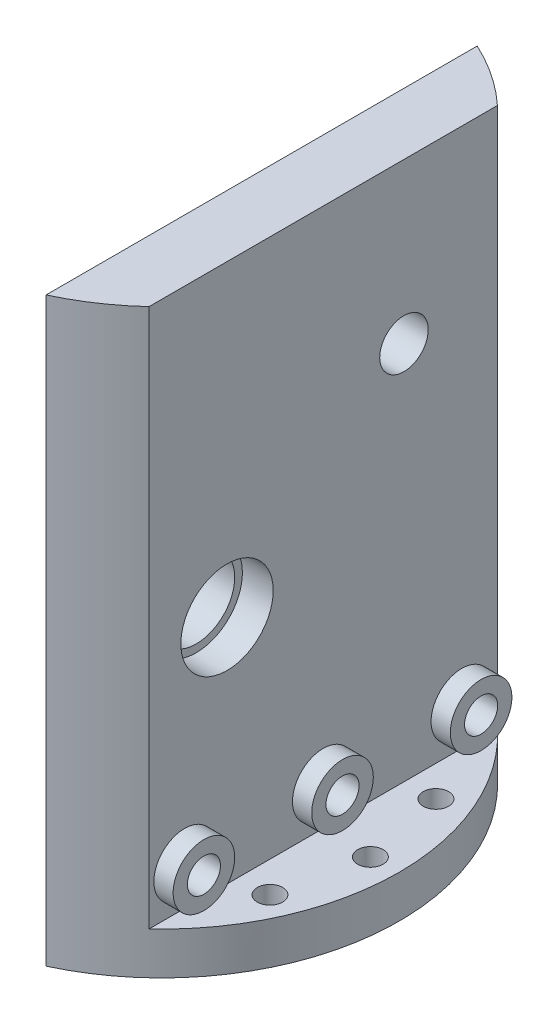
from build123d import *

# Parameters (mm, degrees)
SKETCH1_R                = 28
BOSS_EXTRUDE1_DEPTH      = 3
SKETCH2_R                = 1.625
CUT_EXTRUDE1_DEPTH       = 3
BOSS_EXTRUDE4_START      = 3
BOSS_EXTRUDE4_OUTLINE_R  = 1.625
BOSS_EXTRUDE4_DEPTH      = 70
BOSS_EXTRUDE6_DEPTH      = 7
CUT_EXTRUDE13_START      = -10
CUT_EXTRUDE13_DEPTH      = 10
SKETCH14_R               = 6
CUT_EXTRUDE7_DEPTH       = 4
SKETCH15_R               = 5
CUT_EXTRUDE8_DEPTH       = 37
SKETCH17_R               = 2.15
CUT_EXTRUDE10_DEPTH      = 15.8
CUT_EXTRUDE11_DEPTH      = 5
CUT_EXTRUDE12_START      = -3
CUT_EXTRUDE12_DEPTH      = 3
SKETCH21_W               = 20.621892052
SKETCH21_H               = 10
BOSS_EXTRUDE7_DEPTH      = 7
SKETCH23_R               = 2.15
CUT_EXTRUDE17_DEPTH      = 23
SKETCH25_W               = 2
SKETCH25_H               = 4.7
CUT_EXTRUDE19_DEPTH      = 5
SKETCH26_W               = 20.621892052
SKETCH26_H               = 58
CUT_EXTRUDE21_DEPTH      = 5
CUT_EXTRUDE22_DEPTH      = 5
SKETCH41_R               = 1.625
CUT_EXTRUDE23_DEPTH      = 70
CUT_EXTRUDE24_START      = -39
CUT_EXTRUDE24_DEPTH      = 39
BOSS_EXTRUDE12_START     = -3
SKETCH43_R               = 30.866648668
BOSS_EXTRUDE12_DEPTH     = 3
BOSS_EXTRUDE13_DEPTH     = 70
BOSS_EXTRUDE14_DEPTH     = 70
SKETCH47_R               = 1.625
SKETCH47_R_2             = 1.65
CUT_EXTRUDE26_DEPTH      = 39
SKETCH48_R               = 3.15
CUT_EXTRUDE27_DEPTH      = 39
SKETCH49_R               = 5
CUT_EXTRUDE28_DEPTH      = 10
SKETCH50_R               = 6
CUT_EXTRUDE29_DEPTH      = 4
SKETCH51_R               = 3
CUT_EXTRUDE30_DEPTH      = 2.5
CUT_EXTRUDE31_DEPTH      = 82
CUT_EXTRUDE31_DEPTH_BACK = 10
SKETCH53_R               = 2.15
CUT_EXTRUDE32_DEPTH      = 10
SKETCH54_R               = 4
SKETCH54_R_2             = 2.15
BOSS_EXTRUDE15_DEPTH     = 2.5
SKETCH55_R               = 1.65
BOSS_EXTRUDE16_DEPTH     = 2.5


# Read off the part's stored shape, not the designer's step: Boss-Extrude4, Cut-Extrude13
with BuildPart() as part:
    # Sketch1 → Boss-Extrude1 (new body)
    with BuildSketch(Plane(origin=(0, 0, 0), x_dir=(1, 0, 0), z_dir=(0, 1, 0))):
        with Locations(Location((20, 12.5, 0), (0, 0, 270))):
            Circle(SKETCH1_R)
    extrude(amount=BOSS_EXTRUDE1_DEPTH)

    # Sketch2 → Cut-Extrude1 (cut)
    with BuildSketch(Plane(origin=(0, 3, 0), x_dir=(1, 0, 0), z_dir=(0, 1, 0))):
        with Locations(Location((20, 19.5, 0), (0, 0, 270))):
            Circle(SKETCH2_R)
        with Locations(Location((20, 5.5, 0), (0, 0, 270))):
            Circle(SKETCH2_R)
        with Locations(Location((20, 12.5, 0), (0, 0, 270))):
            Circle(SKETCH2_R)
    extrude(amount=-CUT_EXTRUDE1_DEPTH, mode=Mode.SUBTRACT)

    # Boss-Extrude4 outline → Boss-Extrude4 (add)
    with BuildSketch(Plane(origin=(0, 0, 0), x_dir=(1, 0, 0), z_dir=(0, 1, 0)).offset(BOSS_EXTRUDE4_START)):
        with BuildLine():
            ThreePointArc((3.5, -10.121892052), (48, 12.5), (3.5, 35.121892052))
            Line((3.5, 35.121892052), (3.5, -10.121892052))
        make_face()
        with Locations((20, 5.5)):
            Circle(BOSS_EXTRUDE4_OUTLINE_R, mode=Mode.SUBTRACT)
        with Locations((20, 12.5)):
            Circle(BOSS_EXTRUDE4_OUTLINE_R, mode=Mode.SUBTRACT)
        with Locations((20, 19.5)):
            Circle(BOSS_EXTRUDE4_OUTLINE_R, mode=Mode.SUBTRACT)
    extrude(amount=BOSS_EXTRUDE4_DEPTH)

    # Sketch13 → Boss-Extrude6 (add)
    with BuildSketch(Plane.ZY.offset(-3.5)):
        Polygon((-10, 23), (10, 23), (10.121892052, 23), (10.121892052, 15), (10, 15), (-10, 15), (-10.5, 15), (-10.5, 23), align=None)
    extrude(amount=BOSS_EXTRUDE6_DEPTH)

    # Cut-Extrude13 outline → Cut-Extrude13 (cut)
    with BuildSketch(Plane.ZY.offset(-3.5).offset(CUT_EXTRUDE13_START)):
        with BuildLine():
            Line((-10.5, 33), (-10.5, 23))
            Line((-10.5, 23), (10.121892052, 23))
            Line((10.121892052, 23), (10.121892052, 35.792364821))
            ThreePointArc((10.121892052, 35.792364821), (-1.408923961, 43.405043646), (-10.5, 33))
        make_face()
    extrude(amount=CUT_EXTRUDE13_DEPTH, mode=Mode.SUBTRACT)

    # Sketch14 → Cut-Extrude7 (cut)
    with BuildSketch(Plane.ZY.offset(-3.5)):
        with Locations((-22.981333294, 52.283628291)):
            Circle(SKETCH14_R)
    extrude(amount=-CUT_EXTRUDE7_DEPTH, mode=Mode.SUBTRACT)

    # Sketch15 → Cut-Extrude8 (cut)
    with BuildSketch(Plane.ZY.offset(-7.5)):
        with Locations((-22.981333294, 52.283628291)):
            Circle(SKETCH15_R)
    extrude(amount=-CUT_EXTRUDE8_DEPTH, mode=Mode.SUBTRACT)

    # Sketch17 → Cut-Extrude10 (cut)
    with BuildSketch(Plane.ZY.offset(3.5)):
        with Locations((-5, 18.2)):
            Circle(SKETCH17_R)
        with Locations((5, 18.2)):
            Circle(SKETCH17_R)
    extrude(amount=-CUT_EXTRUDE10_DEPTH, mode=Mode.SUBTRACT)

    # Sketch18 → Cut-Extrude11 (cut)
    with BuildSketch(Plane.ZY.offset(3.5)):
        Polygon((-0.189053974, 23), (1, 23), (1, 18), (-1, 18), (-1, 23), align=None)
    extrude(amount=-CUT_EXTRUDE11_DEPTH, mode=Mode.SUBTRACT)

    # Sketch19 → Cut-Extrude12 (cut)
    with BuildSketch(Plane.ZY.offset(-3.5).offset(CUT_EXTRUDE12_START)):
        with BuildLine():
            Line((10.121892052, 63), (10.121892052, 35.792364821))
            ThreePointArc((10.121892052, 35.792364821), (-1.408923961, 43.405043646), (-10.5, 33))
            Line((-10.5, 33), (-10.5, 62))
            Line((-10.5, 62), (-10.5, 63))
            Line((-10.5, 63), (10.121892052, 63))
        make_face()
    extrude(amount=CUT_EXTRUDE12_DEPTH, mode=Mode.SUBTRACT)

    # Sketch21 → Boss-Extrude7 (add)
    with BuildSketch(Plane.ZY.offset(-3.5)):
        with Locations((-0.189053974, 68)):
            Rectangle(SKETCH21_W, SKETCH21_H)
    extrude(amount=BOSS_EXTRUDE7_DEPTH)

    # Sketch23 → Cut-Extrude17 (cut)
    with BuildSketch(Plane.ZY.offset(3.5)):
        with Locations((-5, 67.7)):
            Circle(SKETCH23_R)
        with Locations((5, 67.7)):
            Circle(SKETCH23_R)
    extrude(amount=-CUT_EXTRUDE17_DEPTH, mode=Mode.SUBTRACT)

    # Sketch25 → Cut-Extrude19 (cut)
    with BuildSketch(Plane.ZY.offset(3.5)):
        with Locations((0, 65.35)):
            Rectangle(SKETCH25_W, SKETCH25_H)
    extrude(amount=-CUT_EXTRUDE19_DEPTH, mode=Mode.SUBTRACT)

    # Sketch26 → Cut-Extrude21 (cut)
    with BuildSketch(Plane.ZY.offset(3.5)):
        with Locations((-0.189053974, 44)):
            Rectangle(SKETCH26_W, SKETCH26_H)
    extrude(amount=-CUT_EXTRUDE21_DEPTH, mode=Mode.SUBTRACT)

    # Sketch27 → Cut-Extrude22 (cut)
    with BuildSketch(Plane.ZY.offset(-6.5)):
        Polygon((10.121892052, 63), (-10.5, 63), (-10.5, 33), (10.121892052, 35.792364821), align=None)
    extrude(amount=-CUT_EXTRUDE22_DEPTH, mode=Mode.SUBTRACT)

    # Sketch41 → Cut-Extrude23 (cut)
    with BuildSketch(Plane(origin=(0, 73, 0), x_dir=(1, 0, 0), z_dir=(0, 1, 0))):
        with BuildLine():
            Line((11.5, 39.178643144), (11.5, 10.5))
            Line((11.5, 10.5), (11.5, -14.178643144))
            ThreePointArc((11.5, -14.178643144), (48, 12.5), (11.5, 39.178643144))
        make_face()
        with Locations(Location((20, 5.5, 0), (0, 0, 270))):
            Circle(SKETCH41_R, mode=Mode.SUBTRACT)
        with Locations(Location((20, 12.5, 0), (0, 0, 270))):
            Circle(SKETCH41_R, mode=Mode.SUBTRACT)
        with Locations(Location((20, 19.5, 0), (0, 0, 270))):
            Circle(SKETCH41_R, mode=Mode.SUBTRACT)
    extrude(amount=-CUT_EXTRUDE23_DEPTH, mode=Mode.SUBTRACT)

    # Sketch42 → Cut-Extrude24 (cut)
    with BuildSketch(Plane(origin=(0, 3, 0), x_dir=(1, 0, 0), z_dir=(0, 1, 0)).offset(CUT_EXTRUDE24_START)):
        with BuildLine():
            ThreePointArc((3.5, 35.121892052), (-6.366648668, 12.5), (3.5, -10.121892052))
            ThreePointArc((3.5, -10.121892052), (-8, 12.5), (3.5, 35.121892052))
        make_face()
    extrude(amount=CUT_EXTRUDE24_DEPTH, mode=Mode.SUBTRACT)

    # Sketch43 → Boss-Extrude12 (add)
    with BuildSketch(Plane(origin=(0, 3, 0), x_dir=(1, 0, 0), z_dir=(0, 1, 0)).offset(BOSS_EXTRUDE12_START)):
        with Locations(Location((24.5, 12.5, 0), (0, 0, 270))):
            Circle(SKETCH43_R)
    extrude(amount=BOSS_EXTRUDE12_DEPTH)

    # Sketch45 → Boss-Extrude13 (add)
    with BuildSketch(Plane(origin=(0, 3, 0), x_dir=(1, 0, 0), z_dir=(0, 1, 0))):
        with BuildLine():
            Line((11.5, 40.495535358), (11.5, 39.178643144))
            ThreePointArc((11.5, 39.178643144), (7.336497035, 37.472698946), (3.5, 35.121892052))
            ThreePointArc((3.5, 35.121892052), (7.288985777, 38.12286068), (11.5, 40.495535358))
        make_face()
        with BuildLine():
            Line((11.5, -14.178643144), (11.5, -15.495535358))
            ThreePointArc((11.5, -15.495535358), (7.288985777, -13.12286068), (3.5, -10.121892052))
            ThreePointArc((3.5, -10.121892052), (7.336497035, -12.472698946), (11.5, -14.178643144))
        make_face()
    extrude(amount=BOSS_EXTRUDE13_DEPTH)

    # Sketch46 → Boss-Extrude14 (add)
    with BuildSketch(Plane(origin=(0, 3, 0), x_dir=(1, 0, 0), z_dir=(0, 1, 0))):
        with BuildLine():
            Line((37.5, 40.495535358), (37.5, 12.5))
            Line((37.5, 12.5), (37.5, -15.495535358))
            ThreePointArc((37.5, -15.495535358), (41.711014223, -13.12286068), (45.5, -10.121892052))
            Line((45.5, -10.121892052), (45.5, 12.5))
            Line((45.5, 12.5), (45.5, 35.121892052))
            ThreePointArc((45.5, 35.121892052), (41.711014223, 38.12286068), (37.5, 40.495535358))
        make_face()
    extrude(amount=BOSS_EXTRUDE14_DEPTH)

    # Sketch47 → Cut-Extrude26 (cut)
    with BuildSketch(Plane(origin=(0, 3, 0), x_dir=(1, 0, 0), z_dir=(0, 1, 0))):
        with Locations(Location((24.638783134, 19.352080003, 0), (0, 0, 270))):
            Circle(SKETCH47_R)
        with Locations(Location((24.638783134, 12.352080003, 0), (0, 0, 270))):
            Circle(SKETCH47_R)
        with Locations(Location((24.638783134, -15.204594071, 0), (0, 0, 270))):
            Circle(SKETCH47_R)
        with Locations(Location((0.774003343, -1.426257034, 0), (0, 0, 270))):
            Circle(SKETCH47_R)
        with Locations(Location((0.774003343, 26.13041704, 0), (0, 0, 270))):
            Circle(SKETCH47_R)
        with Locations(Location((24.638783134, 39.908754076, 0), (0, 0, 270))):
            Circle(SKETCH47_R)
        with Locations(Location((30.700960961, 15.852080003, 0), (0, 0, 270))):
            Circle(SKETCH47_R)
        with Locations(Location((-2.490624188, 12.352080003, 0), (0, 0, 270))):
            Circle(SKETCH47_R)
        with Locations(Location((51.768190456, 12.352080003, 0), (0, 0, 270))):
            Circle(SKETCH47_R_2)
        with Locations(Location((24.638783134, 26.13041704, 0), (0, 0, 270))):
            Circle(SKETCH47_R)
        with Locations(Location((24.638783134, -1.426257034, 0), (0, 0, 270))):
            Circle(SKETCH47_R)
        with Locations(Location((30.700960961, 8.852080003, 0), (0, 0, 270))):
            Circle(SKETCH47_R)
        with Locations(Location((24.638783134, 5.352080003, 0), (0, 0, 270))):
            Circle(SKETCH47_R)
        with Locations(Location((18.576605308, 8.852080003, 0), (0, 0, 270))):
            Circle(SKETCH47_R)
        with Locations(Location((18.576605308, 15.852080003, 0), (0, 0, 270))):
            Circle(SKETCH47_R)
        with Locations(Location((49.503562926, 1.573742966, 0), (0, 0, 270))):
            Circle(SKETCH47_R_2)
        with Locations(Location((49.503562926, 23.13041704, 0), (0, 0, 270))):
            Circle(SKETCH47_R_2)
    extrude(amount=-CUT_EXTRUDE26_DEPTH, mode=Mode.SUBTRACT)

    # Sketch48 → Cut-Extrude27 (cut)
    with BuildSketch(Plane.ZY.offset(-7.5)):
        with Locations((-22.981333294, 52.283628291)):
            Circle(SKETCH48_R)
    extrude(amount=-CUT_EXTRUDE27_DEPTH, mode=Mode.SUBTRACT)

    # Sketch49 → Cut-Extrude28 (cut)
    with BuildSketch(Plane(origin=(45.5, 0, 0), x_dir=(0, 0, -1), z_dir=(1, 0, 0))):
        with Locations((0, 33)):
            Circle(SKETCH49_R)
    extrude(amount=-CUT_EXTRUDE28_DEPTH, mode=Mode.SUBTRACT)

    # Sketch50 → Cut-Extrude29 (cut)
    with BuildSketch(Plane(origin=(45.5, 0, 0), x_dir=(0, 0, -1), z_dir=(1, 0, 0))):
        with Locations((0, 33)):
            Circle(SKETCH50_R)
    extrude(amount=-CUT_EXTRUDE29_DEPTH, mode=Mode.SUBTRACT)

    # Sketch51 → Cut-Extrude30 (cut)
    with BuildSketch(Plane(origin=(11.5, 0, 0), x_dir=(0, 0, -1), z_dir=(1, 0, 0))):
        with Locations((-5, 18.2)):
            Circle(SKETCH51_R)
        with Locations((5, 18.2)):
            Circle(SKETCH51_R)
        with Locations((-5, 67.7)):
            Circle(SKETCH51_R)
        with Locations((5, 67.7)):
            Circle(SKETCH51_R)
    extrude(amount=-CUT_EXTRUDE30_DEPTH, mode=Mode.SUBTRACT)

    # Sketch52 → Cut-Extrude31 (cut, two sides: drawn at the far end of the back side and taken through both)
    with BuildSketch(Plane(origin=(0, 3, 0), x_dir=(1, 0, 0), z_dir=(0, 1, 0)).offset(-CUT_EXTRUDE31_DEPTH_BACK)):
        with BuildLine():
            Line((37.5, 40.495535358), (37.5, -15.495535358))
            ThreePointArc((37.5, -15.495535358), (-6.366648668, 12.5), (37.5, 40.495535358))
        make_face()
    extrude(amount=CUT_EXTRUDE31_DEPTH + CUT_EXTRUDE31_DEPTH_BACK, mode=Mode.SUBTRACT)


with BuildPart() as cut_extrude31_kept_piece:
    # of the separate pieces the step leaves, the one the design keeps (cut_extrude31_pieces_kept)
    add(part.part.solids().sort_by_distance((37.5, 0, 15.495535358))[0])

    # Sketch53 → Cut-Extrude32 (cut)
    with BuildSketch(Plane.ZY.offset(-37.5)):
        with Locations((-30.5, 8)):
            Circle(SKETCH53_R)
        with Locations((-12.5, 8)):
            Circle(SKETCH53_R)
        with Locations((5.5, 8)):
            Circle(SKETCH53_R)
    extrude(amount=-CUT_EXTRUDE32_DEPTH, mode=Mode.SUBTRACT)

    # Sketch54 → Boss-Extrude15 (add)
    # profile 1 of 3: a face of its own
    with BuildSketch(Plane(origin=(45.5, 0, 0), x_dir=(0, 0, -1), z_dir=(1, 0, 0))):
        with Locations((-5.5, 8)):
            Circle(SKETCH54_R)
        with Locations(Location((-5.5, 8, 0), (0, 0, 180))):
            Circle(SKETCH54_R_2, mode=Mode.SUBTRACT)
    # profile 2 of 3: a face of its own
    with BuildSketch(Plane(origin=(45.5, 0, 0), x_dir=(0, 0, -1), z_dir=(1, 0, 0))):
        with Locations((12.5, 8)):
            Circle(SKETCH54_R)
        with Locations(Location((12.5, 8, 0), (0, 0, 180))):
            Circle(SKETCH54_R_2, mode=Mode.SUBTRACT)
    # profile 3 of 3: a face of its own
    with BuildSketch(Plane(origin=(45.5, 0, 0), x_dir=(0, 0, -1), z_dir=(1, 0, 0))):
        with Locations((30.5, 8)):
            Circle(SKETCH54_R)
        with Locations(Location((30.5, 8, 0), (0, 0, 180))):
            Circle(SKETCH54_R_2, mode=Mode.SUBTRACT)
    extrude(amount=BOSS_EXTRUDE15_DEPTH)

    # Sketch55 → Boss-Extrude16 (add)
    with BuildSketch(Plane.XZ):
        with BuildLine():
            Line((37.5, 15.495535358), (37.5, -40.495535358))
            ThreePointArc((37.5, -40.495535358), (55.366648668, -12.5), (37.5, 15.495535358))
        make_face()
        with Locations(Location((49.503562926, -1.573742966, 0), (0, 0, 90))):
            Circle(SKETCH55_R, mode=Mode.SUBTRACT)
        with Locations(Location((51.768190456, -12.352080003, 0), (0, 0, 90))):
            Circle(SKETCH55_R, mode=Mode.SUBTRACT)
        with Locations(Location((49.503562926, -23.13041704, 0), (0, 0, 90))):
            Circle(SKETCH55_R, mode=Mode.SUBTRACT)
    extrude(amount=BOSS_EXTRUDE16_DEPTH)


solid = cut_extrude31_kept_piece.part
